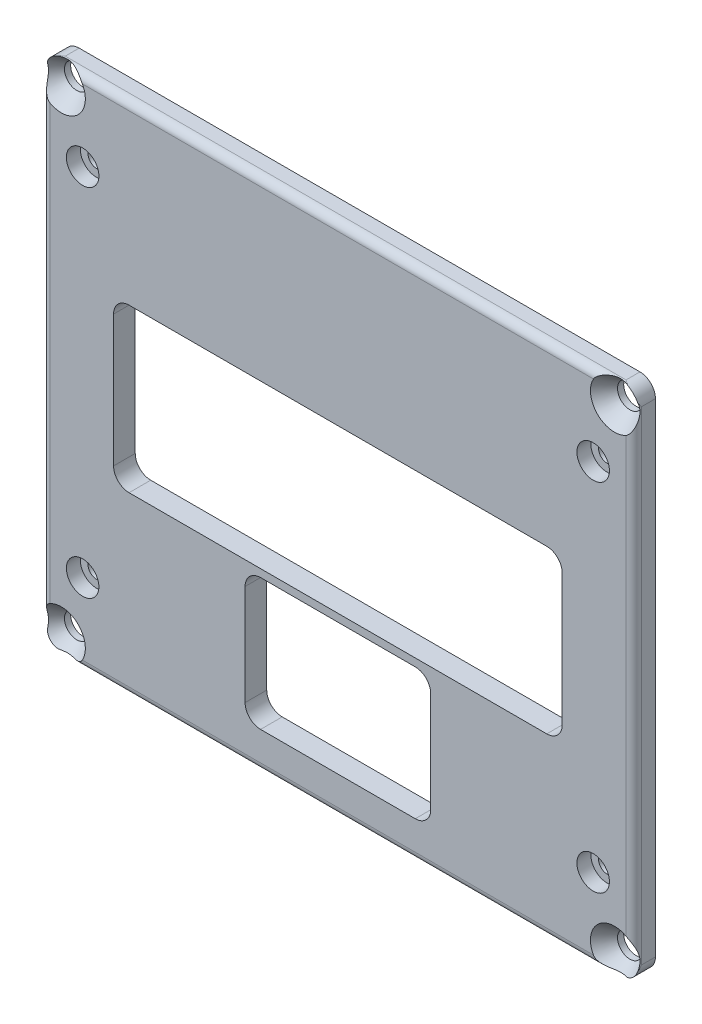
from build123d import *

# Parameters (mm, degrees)
SKETCH1_R           = 1.6
BOSS_EXTRUDE1_DEPTH = 2.8
CUT_EXTRUDE2_START  = 2.8
SKETCH1_6_R         = 2.1
CUT_EXTRUDE2_DEPTH  = 1.8
CHAMFER1_SIZE       = 1.5
CHAMFER1_SIZE_2     = 2
FILLET1_START       = -33.224011807
FILLET1_DEPTH       = 66.448023614
FILLET1_START_2     = -38.224011807
FILLET1_2_DEPTH     = 76.3236742


with BuildPart() as part:
    # Sketch1 → Boss-Extrude1 (new body)
    with BuildSketch(Plane(origin=(0, 0, 0), x_dir=(0, 1, 0), z_dir=(0, 0, 1))):
        with BuildLine():
            Line((31.25, 38.25), (-31.25, 38.25))
            ThreePointArc((-31.25, 38.25), (-32.664213562, 37.664213562), (-33.25, 36.25))
            Line((-33.25, 36.25), (-33.25, -36.25))
            ThreePointArc((-33.25, -36.25), (-32.664213562, -37.664213562), (-31.25, -38.25))
            Line((-31.25, -38.25), (31.25, -38.25))
            ThreePointArc((31.25, -38.25), (32.664213562, -37.664213562), (33.25, -36.25))
            Line((33.25, -36.25), (33.25, 36.25))
            ThreePointArc((33.25, 36.25), (32.664213562, 37.664213562), (31.25, 38.25))
        make_face()
        with Locations(Location((-30.75, -35.75, 0), (0, 0, 270))):
            Circle(SKETCH1_R, mode=Mode.SUBTRACT)
        with Locations(Location((30.75, -35.75, 0), (0, 0, 270))):
            Circle(SKETCH1_R, mode=Mode.SUBTRACT)
        with BuildLine():
            ThreePointArc((-28.5, 10), (-27.914213562, 11.414213562), (-26.5, 12))
            Line((-26.5, 12), (-13.5, 12))
            ThreePointArc((-13.5, 12), (-12.085786438, 11.414213562), (-11.5, 10))
            Line((-11.5, 10), (-11.5, -10))
            ThreePointArc((-11.5, -10), (-12.085786438, -11.414213562), (-13.5, -12))
            Line((-13.5, -12), (-26.5, -12))
            ThreePointArc((-26.5, -12), (-27.914213562, -11.414213562), (-28.5, -10))
            Line((-28.5, -10), (-28.5, 10))
        make_face(mode=Mode.SUBTRACT)
        with Locations(Location((-30.75, 35.75, 0), (0, 0, 270))):
            Circle(SKETCH1_R, mode=Mode.SUBTRACT)
        with BuildLine():
            Line((-10.5, -27), (-10.5, 27))
            ThreePointArc((-10.5, 27), (-9.914213562, 28.414213562), (-8.5, 29))
            Line((-8.5, 29), (8.5, 29))
            ThreePointArc((8.5, 29), (9.914213562, 28.414213562), (10.5, 27))
            Line((10.5, 27), (10.5, -27))
            ThreePointArc((10.5, -27), (9.914213562, -28.414213562), (8.5, -29))
            Line((8.5, -29), (-8.5, -29))
            ThreePointArc((-8.5, -29), (-9.914213562, -28.414213562), (-10.5, -27))
        make_face(mode=Mode.SUBTRACT)
        with Locations(Location((30.75, 35.75, 0), (0, 0, 270))):
            Circle(SKETCH1_R, mode=Mode.SUBTRACT)
    extrude(amount=BOSS_EXTRUDE1_DEPTH)

    # Sketch1<6> → Cut-Extrude2 (cut)
    with BuildSketch(Plane(origin=(0, 0, 0), x_dir=(0, 1, 0), z_dir=(0, 0, 1)).offset(CUT_EXTRUDE2_START)):
        with Locations(Location((-23, 33, 0), (0, 0, 270))):
            Circle(SKETCH1_6_R)
        with Locations(Location((23, 33, 0), (0, 0, 270))):
            Circle(SKETCH1_6_R)
        with Locations(Location((23, -33, 0), (0, 0, 270))):
            Circle(SKETCH1_6_R)
        with Locations(Location((-23, -33, 0), (0, 0, 270))):
            Circle(SKETCH1_6_R)
    extrude(amount=-CUT_EXTRUDE2_DEPTH, mode=Mode.SUBTRACT)

    # Cut-Extrude1 cone 1 section (through the dimple's axis) → Cut-Extrude1 (revolve, cut)
    with BuildSketch(Plane(origin=(33, -23, 1), x_dir=(0, -1, 0), z_dir=(1, 0, 0))):
        Polygon((0, 0), (1.1, 0), (0, 12.573057533), align=None)
    revolve(axis=Axis((33, -23, 1), (0, 0, -1)), mode=Mode.SUBTRACT)

    # Cut-Extrude1 cone 2 section (through the dimple's axis) → Cut-Extrude1 cone 2 (revolve, cut)
    with BuildSketch(Plane(origin=(-33, -23, 1), x_dir=(0, -1, 0), z_dir=(1, 0, 0))):
        Polygon((0, 0), (1.1, 0), (0, 12.573057533), align=None)
    revolve(axis=Axis((-33, -23, 1), (0, 0, -1)), mode=Mode.SUBTRACT)

    # Cut-Extrude1 cone 3 section (through the dimple's axis) → Cut-Extrude1 cone 3 (revolve, cut)
    with BuildSketch(Plane(origin=(-33, 23, 1), x_dir=(0, -1, 0), z_dir=(1, 0, 0))):
        Polygon((0, 0), (1.1, 0), (0, 12.573057533), align=None)
    revolve(axis=Axis((-33, 23, 1), (0, 0, -1)), mode=Mode.SUBTRACT)

    # Cut-Extrude1 cone 4 section (through the dimple's axis) → Cut-Extrude1 cone 4 (revolve, cut)
    with BuildSketch(Plane(origin=(33, 23, 1), x_dir=(0, -1, 0), z_dir=(1, 0, 0))):
        Polygon((0, 0), (1.1, 0), (0, 12.573057533), align=None)
    revolve(axis=Axis((33, 23, 1), (0, 0, -1)), mode=Mode.SUBTRACT)

    # Chamfer1
    # the kernel refuses this chamfer: 2, 1.5 mm, written as the material it takes off along each edge
    with BuildSketch(Plane(origin=(-35.75, -30.75, 2.8), x_dir=(1, 0, 0), z_dir=(0, -1, 0))) as chamfer1_piece_1:
        Polygon((1.6 + CHAMFER1_SIZE, 0), (1.6, -CHAMFER1_SIZE_2), (1.6, 0), align=None)
    revolve(axis=Axis((-35.75, -30.75, 2.8), (0, 0, 1)), mode=Mode.SUBTRACT)
    with BuildSketch(Plane(origin=(35.75, -30.75, 2.8), x_dir=(1, 0, 0), z_dir=(0, -1, 0))) as chamfer1_piece_2:
        Polygon((1.6 + CHAMFER1_SIZE, 0), (1.6, -CHAMFER1_SIZE_2), (1.6, 0), align=None)
    revolve(axis=Axis((35.75, -30.75, 2.8), (0, 0, 1)), mode=Mode.SUBTRACT)
    with BuildSketch(Plane(origin=(35.75, 30.75, 2.8), x_dir=(1, 0, 0), z_dir=(0, -1, 0))) as chamfer1_piece_3:
        Polygon((1.6 + CHAMFER1_SIZE, 0), (1.6, -CHAMFER1_SIZE_2), (1.6, 0), align=None)
    revolve(axis=Axis((35.75, 30.75, 2.8), (0, 0, 1)), mode=Mode.SUBTRACT)
    with BuildSketch(Plane(origin=(-35.75, 30.75, 2.8), x_dir=(1, 0, 0), z_dir=(0, -1, 0))) as chamfer1_piece_4:
        Polygon((1.6 + CHAMFER1_SIZE, 0), (1.6, -CHAMFER1_SIZE_2), (1.6, 0), align=None)
    revolve(axis=Axis((-35.75, 30.75, 2.8), (0, 0, 1)), mode=Mode.SUBTRACT)

    # Fillet1: read off the stored shape, not the designer's step
    # Fillet1 outline → Fillet1 (cut)
    with BuildSketch(Plane(origin=(0, 0, 0), x_dir=(1, 0, 0), z_dir=(0, 1, 0)).offset(FILLET1_START)):
        with BuildLine():
            ThreePointArc((38.25, -1.8), (37.957106781, -2.507106781), (37.25, -2.8))
            Line((37.25, -2.8), (38.25, -2.8))
            Line((38.25, -2.8), (38.25, -1.8))
        make_face()
        with BuildLine():
            ThreePointArc((-37.25, -2.8), (-37.957106781, -2.507106781), (-38.25, -1.8))
            Line((-38.25, -1.8), (-38.25, -2.8))
            Line((-38.25, -2.8), (-37.25, -2.8))
        make_face()
    extrude(amount=FILLET1_DEPTH, mode=Mode.SUBTRACT)

    # Fillet1 2 outline → Fillet1 2 (cut)
    with BuildSketch(Plane.YZ.offset(FILLET1_START_2)):
        with BuildLine():
            Line((-33.25, 2.8), (-33.25, 1.8))
            ThreePointArc((-33.25, 1.8), (-32.957106781, 2.507106781), (-32.25, 2.8))
            Line((-32.25, 2.8), (-33.25, 2.8))
        make_face()
        with BuildLine():
            Line((33.25, 2.8), (32.25, 2.8))
            ThreePointArc((32.25, 2.8), (32.957106781, 2.507106781), (33.25, 1.8))
            Line((33.25, 1.8), (33.25, 2.8))
        make_face()
    extrude(amount=FILLET1_2_DEPTH, mode=Mode.SUBTRACT)


solid = part.part
